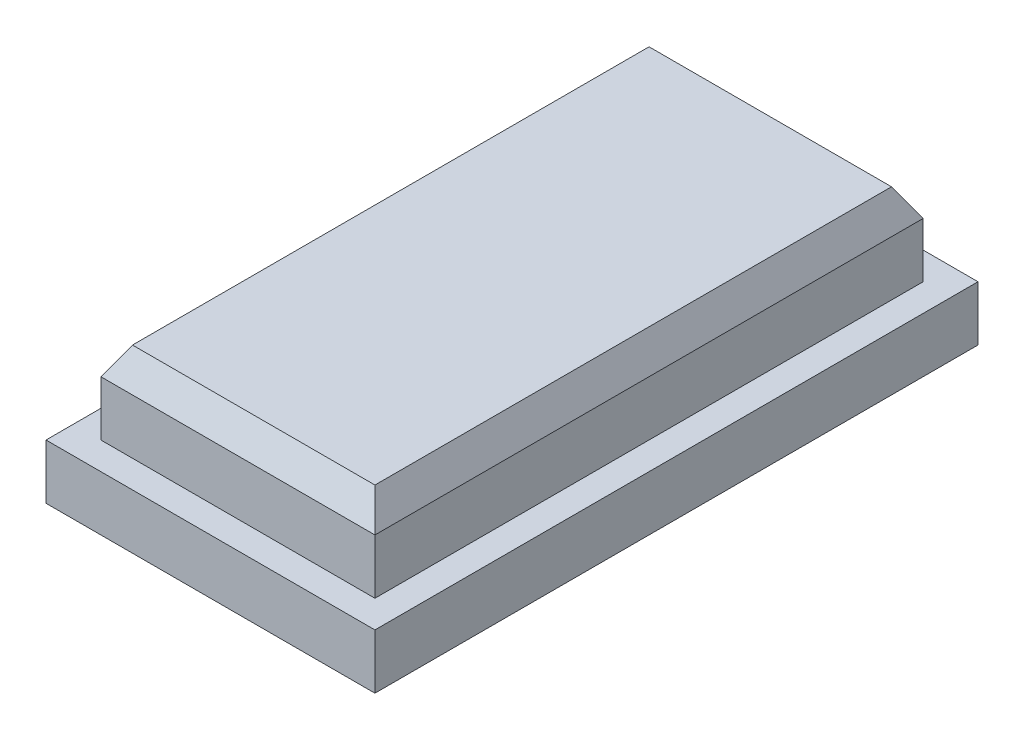
from build123d import *
from OCP.BRepFilletAPI import BRepFilletAPI_MakeChamfer

# Parameters (mm, degrees)
SKETCH1_W           = 12
SKETCH1_H           = 22
BOSS_EXTRUDE1_DEPTH = 2
SKETCH2_W           = 10
SKETCH2_H           = 20
BOSS_EXTRUDE2_DEPTH = 3
CHAMFER1_SIZE       = 1
CHAMFER1_SIZE2      = 0.577350269


with BuildPart() as part:
    # Sketch1 → Boss-Extrude1 (new body)
    with BuildSketch(Plane(origin=(0, 0, 0), x_dir=(1, 0, 0), z_dir=(0, 1, 0))):
        Rectangle(SKETCH1_W, SKETCH1_H)
    extrude(amount=BOSS_EXTRUDE1_DEPTH)

    # Sketch2 → Boss-Extrude2 (add)
    with BuildSketch(Plane(origin=(0, 2, 0), x_dir=(1, 0, 0), z_dir=(0, 1, 0))):
        Rectangle(SKETCH2_W, SKETCH2_H)
    extrude(amount=BOSS_EXTRUDE2_DEPTH)

    # Chamfer1: one chamfer whose edges measure the first distance from different faces: ONE call of the kernel's chamfer builder (chamfer() names one face for all edges)
    chamfer1_edges_1 = [part.edges().sort_by_distance(p)[0] for p in [
        (0, 5, -10),
    ]]
    chamfer1_side_1 = [part.faces().sort_by_distance(p)[0] for p in [
        (0, 3.5, -10),
    ]]
    chamfer1_edges_2 = [part.edges().sort_by_distance(p)[0] for p in [
        (5, 5, 0),
    ]]
    chamfer1_side_2 = [part.faces().sort_by_distance(p)[0] for p in [
        (5, 3.5, 0),
    ]]
    chamfer1_edges_3 = [part.edges().sort_by_distance(p)[0] for p in [
        (0, 5, 10),
    ]]
    chamfer1_side_3 = [part.faces().sort_by_distance(p)[0] for p in [
        (0, 3.5, 10),
    ]]
    chamfer1_edges_4 = [part.edges().sort_by_distance(p)[0] for p in [
        (-5, 5, 0),
    ]]
    chamfer1_side_4 = [part.faces().sort_by_distance(p)[0] for p in [
        (-5, 3.5, 0),
    ]]
    chamfer1 = BRepFilletAPI_MakeChamfer(part.part.solid().wrapped)
    for e in chamfer1_edges_1:
        chamfer1.Add(CHAMFER1_SIZE, CHAMFER1_SIZE2, e.wrapped, chamfer1_side_1[0].wrapped)  # the first distance lies on this face
    for e in chamfer1_edges_2:
        chamfer1.Add(CHAMFER1_SIZE, CHAMFER1_SIZE2, e.wrapped, chamfer1_side_2[0].wrapped)  # the first distance lies on this face
    for e in chamfer1_edges_3:
        chamfer1.Add(CHAMFER1_SIZE, CHAMFER1_SIZE2, e.wrapped, chamfer1_side_3[0].wrapped)  # the first distance lies on this face
    for e in chamfer1_edges_4:
        chamfer1.Add(CHAMFER1_SIZE, CHAMFER1_SIZE2, e.wrapped, chamfer1_side_4[0].wrapped)  # the first distance lies on this face
    add(Compound.cast(chamfer1.Shape()), mode=Mode.REPLACE)


solid = part.part
